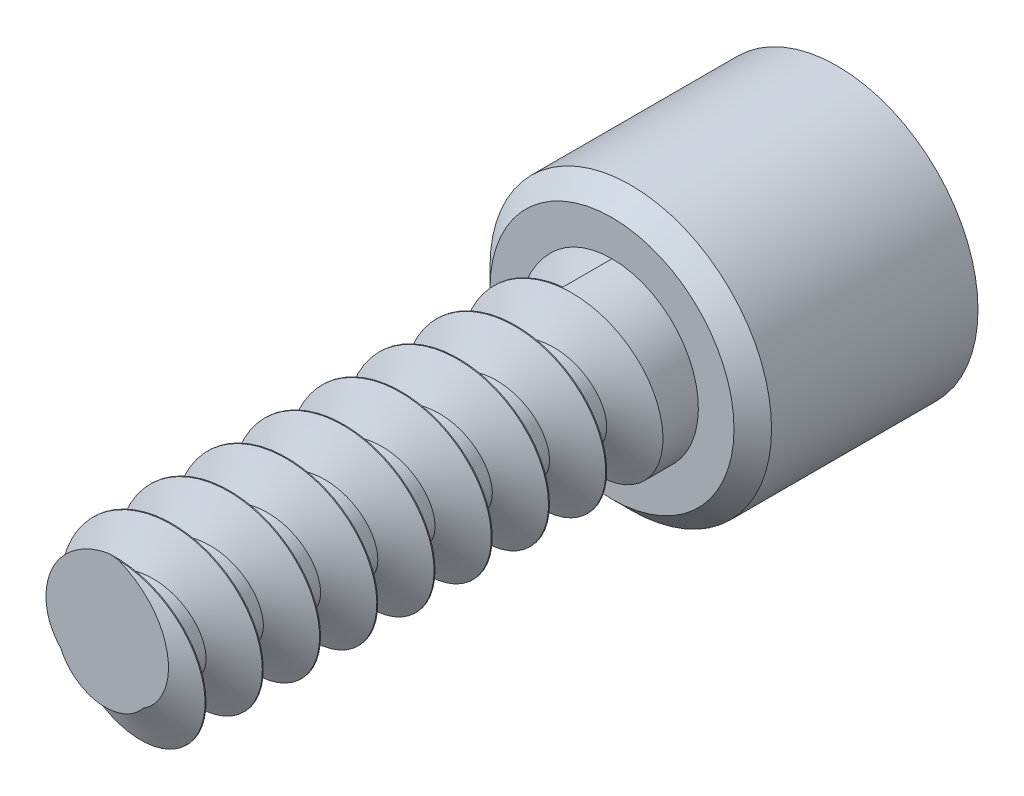
from build123d import *

# Parameters (mm, degrees)
SKETCH1_R           = 7.5
BOSS_EXTRUDE1_DEPTH = 12
SKETCH4_R           = 4.6
BOSS_EXTRUDE2_DEPTH = 27
CUT_SWEEP9_PITCH    = 3.05
CHAMFER1_SIZE       = 1
SKETCH12_W          = 8
SKETCH12_H          = 1.5
CUT_EXTRUDE1_DEPTH  = 8


with BuildPart() as part:
    # Sketch1 → Boss-Extrude1 (new body)
    with BuildSketch(Plane.XY):
        with Locations((-12.752577068, 7.568118166)):
            Circle(SKETCH1_R)
    extrude(amount=BOSS_EXTRUDE1_DEPTH)

    # Sketch4 → Boss-Extrude2 (add)
    with BuildSketch(Plane.XY.offset(12)):
        with Locations((-12.752577068, 7.568118166)):
            Circle(SKETCH4_R)
    extrude(amount=BOSS_EXTRUDE2_DEPTH)

    # Cut-Sweep9: arcs per turn and ends read off the stored shape
    # Cut-Sweep9: the profile of 3DSketch4 profile screwed along a right-hand helix through 9 turns, 10 arcs to a turn; built about Z, then put on its axis
    cut_sweep9_z = Axis((0, 0, 0), (0, 0, 1))
    cut_sweep9_corners = [(4.600300221, -1.3972e-05, -3.071344713), (4.600300221, -1.3972e-05, -0.071044865), (2.597515134, 0.087488351, -1.071194789), (2.597515134, 0.087488351, -2.071194789)]
    with BuildLine(mode=Mode.PRIVATE) as cut_sweep9_profile:
        Line(cut_sweep9_corners[0], cut_sweep9_corners[1])
        Line(cut_sweep9_corners[1], cut_sweep9_corners[2])
        Line(cut_sweep9_corners[2], cut_sweep9_corners[3])
        Line(cut_sweep9_corners[3], cut_sweep9_corners[0])
    cut_sweep9_cap = Face(cut_sweep9_profile.wire())
    cut_sweep9_turn_angles = [0, 18, 36, 54, 72, 90, 108, 126, 144, 162, 180, 198, 216, 234, 252, 270, 288, 306, 324, 342, 360]
    cut_sweep9_turn_weights = [1, 0.9510565162951535, 1, 0.9510565162951535, 1, 0.9510565162951535, 1, 0.9510565162951535, 1, 0.9510565162951535, 1, 0.9510565162951535, 1, 0.9510565162951535, 1, 0.9510565162951535, 1, 0.9510565162951535, 1, 0.9510565162951535, 1]
    cut_sweep9_turn_rails = [Edge.make_bspline([Vector(p[0], p[1], 0).rotate(cut_sweep9_z, cut_sweep9_turn_angles[k]) / cut_sweep9_turn_weights[k] + Vector(0, 0, p[2] + CUT_SWEEP9_PITCH * cut_sweep9_turn_angles[k] / 360) for k in range(21)], [0, 0, 0, 1, 1, 2, 2, 3, 3, 4, 4, 5, 5, 6, 6, 7, 7, 8, 8, 9, 9, 10, 10, 10], 2, cut_sweep9_turn_weights) for p in cut_sweep9_corners]
    cut_sweep9_turn_sides = [Face.make_surface_from_curves(cut_sweep9_turn_rails[p[0]], cut_sweep9_turn_rails[p[1]]) for p in [(0, 1), (1, 2), (2, 3), (3, 0)]]
    cut_sweep9 = Plane(origin=(-12.752577068, 7.568118166, 39), x_dir=(0, 1, 0), z_dir=(0, 0, -1)) * Solid(Shell([*[p.moved(Location((0, 0, CUT_SWEEP9_PITCH * i))) for i in range(9) for p in cut_sweep9_turn_sides], cut_sweep9_cap, cut_sweep9_cap.rotate(cut_sweep9_z, 3240).moved(Location((0, 0, CUT_SWEEP9_PITCH * 3240 / 360)))]))
    add(cut_sweep9, mode=Mode.SUBTRACT)

    # Chamfer1
    chamfer1_edges = [part.edges().sort_by_distance(p)[0] for p in [
        (-20.252577068, 7.568118166, 12),
    ]]
    chamfer(chamfer1_edges, length=CHAMFER1_SIZE)

    # Sketch12 → Cut-Extrude1 (cut)
    with BuildSketch(Plane(origin=(0, 0, 0), x_dir=(-1, 0, 0), z_dir=(0, 0, -1))):
        with Locations((12.752577068, 7.568118166)):
            Rectangle(SKETCH12_W, SKETCH12_H)
    extrude(amount=-CUT_EXTRUDE1_DEPTH, mode=Mode.SUBTRACT)


solid = part.part
